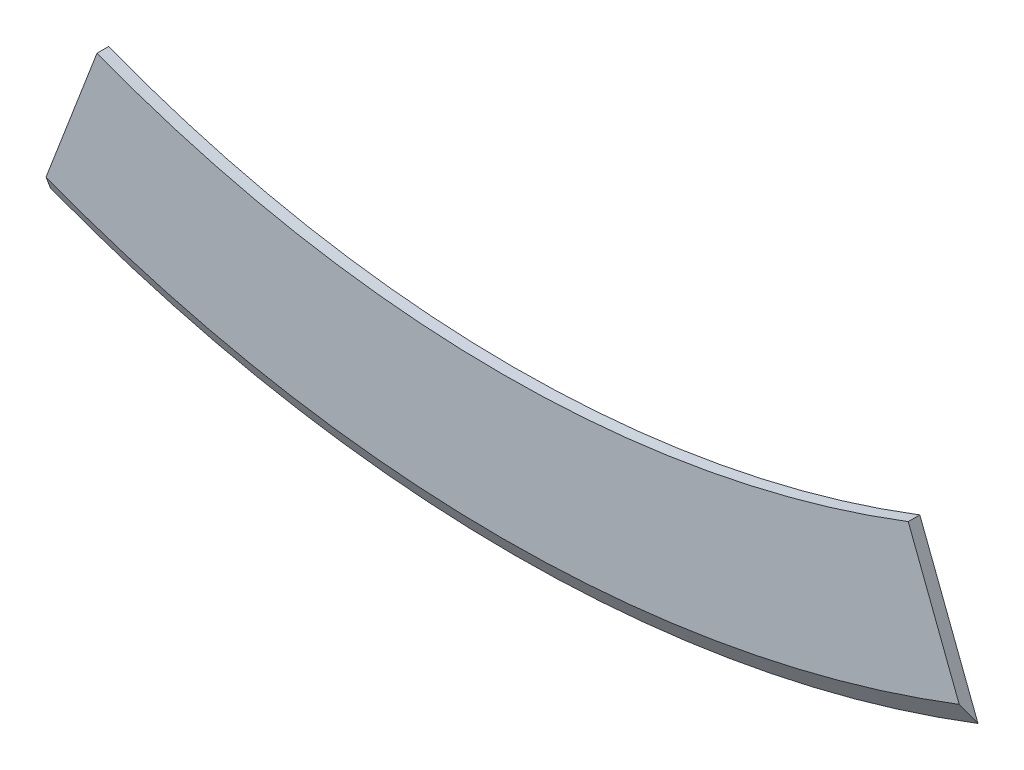
from build123d import *

# Parameters (mm, degrees)
BOSS_EXTRU_1_DEPTH = 3
CHANFREIN1_SIZE2   = 5.196152423
CHANFREIN1_SIZE    = 3


with BuildPart() as part:
    # Esquisse1 → Boss.-Extru.1 (new body)
    with BuildSketch(Plane.XY):
        with BuildLine():
            Line((-120, 22.240685392), (-104.948546119, 61.451063305))
            ThreePointArc((-104.948546119, 61.451063305), (0, 42), (104.948546119, 61.451063305))
            Line((104.948546119, 61.451063305), (120, 22.240685392))
            ThreePointArc((120, 22.240685392), (0, 0), (-120, 22.240685392))
        make_face()
    extrude(amount=BOSS_EXTRU_1_DEPTH)

    # Chanfrein1
    chanfrein1_edges = [part.edges().sort_by_distance(p)[0] for p in [
        (0, 0, 3),
    ]]
    chanfrein1_side = [part.faces().sort_by_distance(p)[0] for p in [
        (0, 0, 2.94),
    ]]
    chamfer(chanfrein1_edges, length=CHANFREIN1_SIZE - 0.0001, length2=CHANFREIN1_SIZE2 - 0.0001, reference=chanfrein1_side[0])  # a hair under: the kernel refuses the full size


solid = part.part
